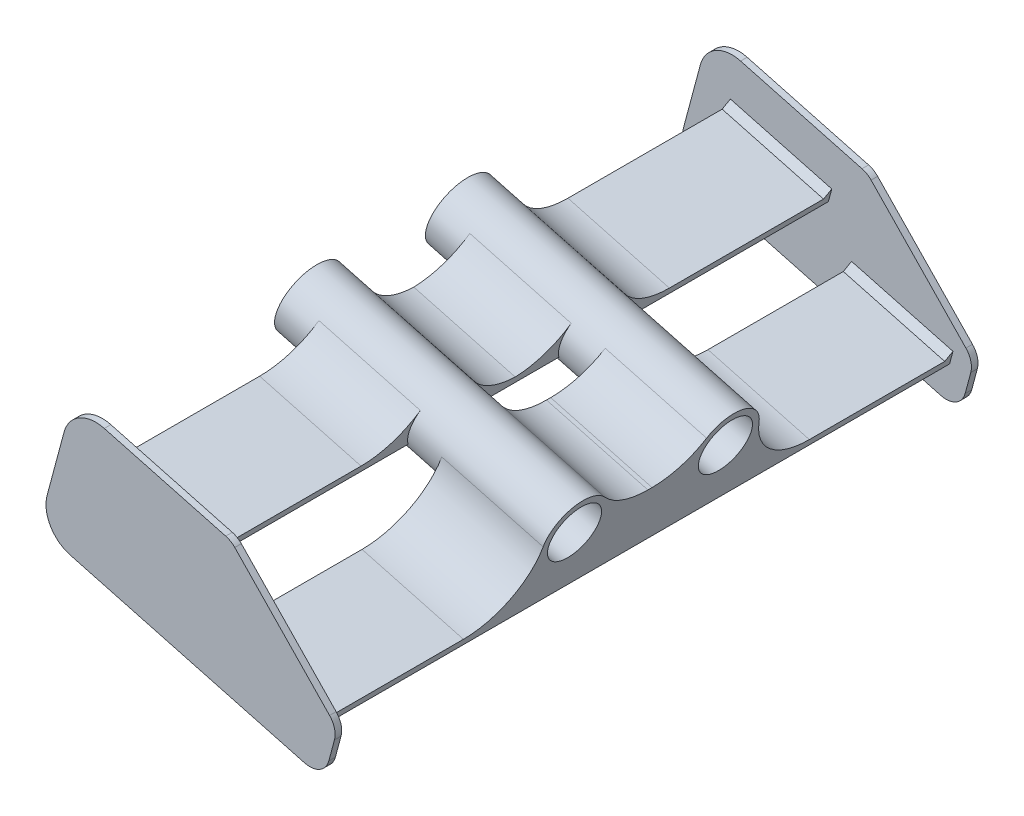
from build123d import *

# Parameters (mm, degrees)
BOSS_EXTRUDE1_DEPTH = 1
BOSS_EXTRUDE2_DEPTH = 96
BOSS_EXTRUDE3_DEPTH = 1
BOSS_EXTRUDE4_DEPTH = 16
EXTRUDE_THIN1_REACH = 110.549
CUT_EXTRUDE1_DEPTH  = 102.965680501
CUT_EXTRUDE2_DEPTH  = 102.965680501
FILLET1_START       = -19
FILLET1_DEPTH       = 16
FILLET2_R           = 10
FILLET3_R           = 10
FILLET4_R           = 10
CHAMFER1_SIZE       = 1
CHAMFER2_SIZE       = 1
SKETCH8_R           = 1
CUT_EXTRUDE3_DEPTH  = 3


with BuildPart() as part:
    # Sketch1 → Boss-Extrude1 (new body)
    with BuildSketch(Plane.XY):
        with BuildLine():
            Line((-1.180699325, 1.221103194), (-15.635082302, 16.170119303))
            ThreePointArc((-15.635082302, 16.170119303), (-16.269985561, 16.670148445), (-17.01532588, 16.982556993))
            Line((-17.01532588, 16.982556993), (-35.53120451, 21.94387172))
            ThreePointArc((-35.53120451, 21.94387172), (-39.325299736, 21.444369607), (-41.654928867, 18.408337814))
            Line((-41.654928867, 18.408337814), (-44.243119318, 8.749079551))
            ThreePointArc((-44.243119318, 8.749079551), (-43.743617206, 4.954984325), (-40.707585412, 2.625355194))
            Line((-40.707585412, 2.625355194), (-4.96832984, -6.950949475))
            ThreePointArc((-4.96832984, -6.950949475), (-2.691872704, -6.651248207), (-1.294095226, -4.829629131))
            Line((-1.294095226, -4.829629131), (-0.43962256, -1.640693729))
            ThreePointArc((-0.43962256, -1.640693729), (-0.433194836, -0.11217799), (-1.180699325, 1.221103194))
        make_face()
    extrude(amount=-BOSS_EXTRUDE1_DEPTH)

    # Sketch2 → Boss-Extrude2 (add)
    with BuildSketch(Plane(origin=(0, 0, -1), x_dir=(-1, 0, 0), z_dir=(0, 0, -1))):
        Polygon((3.415415569, -1.155394517), (3.674234614, -2.121320344), (19.129047835, 2.019784378), (18.87022879, 2.985710204), align=None)
        Polygon((21.888124605, 11.041286214), (22.146943651, 10.075360388), (37.601756871, 14.216465109), (37.342937826, 15.182390936), align=None)
    extrude(amount=BOSS_EXTRUDE2_DEPTH)

    # Sketch3 → Boss-Extrude3 (add)
    with BuildSketch(Plane(origin=(0, 0, -97), x_dir=(-1, 0, 0), z_dir=(0, 0, -1))):
        with BuildLine():
            Line((4.96832984, -6.950949475), (40.707585412, 2.625355194))
            ThreePointArc((40.707585412, 2.625355194), (43.743617206, 4.954984325), (44.243119318, 8.749079551))
            Line((44.243119318, 8.749079551), (41.654928867, 18.408337814))
            ThreePointArc((41.654928867, 18.408337814), (39.325299736, 21.444369607), (35.53120451, 21.94387172))
            Line((35.53120451, 21.94387172), (17.01532588, 16.982556993))
            ThreePointArc((17.01532588, 16.982556993), (16.269985561, 16.670148445), (15.635082302, 16.170119303))
            Line((15.635082302, 16.170119303), (1.180699325, 1.221103194))
            ThreePointArc((1.180699325, 1.221103194), (0.433194836, -0.11217799), (0.43962256, -1.640693729))
            Line((0.43962256, -1.640693729), (1.294095226, -4.829629131))
            ThreePointArc((1.294095226, -4.829629131), (2.691872704, -6.651248207), (4.96832984, -6.950949475))
        make_face()
    extrude(amount=BOSS_EXTRUDE3_DEPTH)

    # Sketch4 → Boss-Extrude4 (add)
    with BuildSketch(Plane(origin=(-2.897777479, 0.776457135, 0), x_dir=(0, 0, -1), z_dir=(0.9659258262890703, -0.25881904510251386, 0))):
        with BuildLine():
            Line((49, 6), (49, -2))
            Line((49, -2), (65.5, -2))
            Line((65.5, -2), (65.5, 6))
            ThreePointArc((65.5, 6), (60.5, 1), (55.5, 6))
            Line((55.5, 6), (49, 6))
        make_face()
        with BuildLine():
            Line((32.5, 6), (32.5, -2))
            Line((32.5, -2), (49, -2))
            Line((49, -2), (49, 6))
            Line((49, 6), (42.5, 6))
            ThreePointArc((42.5, 6), (37.5, 1), (32.5, 6))
        make_face()
    extrude(amount=-BOSS_EXTRUDE4_DEPTH)

    # Extrude-Thin1: up to this face of the body (flat: up to its plane)
    extrude_thin1_end = Plane(part.part.faces().sort_by_distance((-42.949024093, 13.578708682, -97.5))[0])
    # Sketch5 → Extrude-Thin1 (add, up to the picked face)
    with BuildSketch(Plane(origin=(-2.897777479, 0.776457135, 0), x_dir=(0, 0, -1), z_dir=(0.9659258262890703, -0.25881904510251386, 0)), mode=Mode.PRIVATE) as extrude_thin1_sk1:
        with BuildLine():
            ThreePointArc((55.5, 6), (60.5, 1), (65.5, 6))
            ThreePointArc((65.5, 6), (60.5, 11), (55.5, 6))
        make_face()
        with BuildLine():
            ThreePointArc((56.5, 6), (60.5, 2), (64.5, 6))
            ThreePointArc((64.5, 6), (60.5, 10), (56.5, 6))
        make_face(mode=Mode.SUBTRACT)
    extrude_thin1_tool1 = split(extrude(extrude_thin1_sk1.sketch, amount=-EXTRUDE_THIN1_REACH, mode=Mode.PRIVATE), bisect_by=extrude_thin1_end, keep=Keep.BOTH, mode=Mode.PRIVATE)
    # Sketch5 → Extrude-Thin1 (add, up to the picked face)
    with BuildSketch(Plane(origin=(-2.897777479, 0.776457135, 0), x_dir=(0, 0, -1), z_dir=(0.9659258262890703, -0.25881904510251386, 0)), mode=Mode.PRIVATE) as extrude_thin1_sk2:
        with BuildLine():
            ThreePointArc((32.5, 6), (37.5, 1), (42.5, 6))
            ThreePointArc((42.5, 6), (37.5, 11), (32.5, 6))
        make_face()
        with BuildLine():
            ThreePointArc((33.5, 6), (37.5, 2), (41.5, 6))
            ThreePointArc((41.5, 6), (37.5, 10), (33.5, 6))
        make_face(mode=Mode.SUBTRACT)
    extrude_thin1_tool2 = split(extrude(extrude_thin1_sk2.sketch, amount=-EXTRUDE_THIN1_REACH, mode=Mode.PRIVATE), bisect_by=extrude_thin1_end, keep=Keep.BOTH, mode=Mode.PRIVATE)
    add(extrude_thin1_tool1.solids().sort_by(Axis((-2.602356, 1.878986, -60.5), (-0.9659258262890703, 0.25881904510251386, 0)))[0])
    add(extrude_thin1_tool2.solids().sort_by(Axis((-2.602356, 1.878986, -37.5), (-0.9659258262890703, 0.25881904510251386, 0)))[0])

    # Sketch6 → Cut-Extrude1 (cut, through all)
    with BuildSketch(Plane(origin=(-23.182219831, 6.211657082, 0), x_dir=(0, 0, -1), z_dir=(0.9659258262890705, -0.2588190451025127, 0))):
        with BuildLine():
            Line((57.035898385, 4), (63.964101615, 4))
            ThreePointArc((63.964101615, 4), (64.202459174, 4.486132084), (64.372983346, 5))
            Line((64.372983346, 5), (56.627016654, 5))
            ThreePointArc((56.627016654, 5), (56.797540826, 4.486132084), (57.035898385, 4))
        make_face()
    extrude(amount=-CUT_EXTRUDE1_DEPTH, mode=Mode.SUBTRACT)

    # Sketch7 → Cut-Extrude2 (cut, through all)
    with BuildSketch(Plane(origin=(-23.182219831, 6.211657082, 0), x_dir=(0, 0, -1), z_dir=(0.9659258262890704, -0.25881904510251263, 0))):
        with BuildLine():
            Line((34.035898385, 4), (40.964101615, 4))
            ThreePointArc((40.964101615, 4), (41.202459174, 4.486132084), (41.372983346, 5))
            Line((41.372983346, 5), (33.627016654, 5))
            ThreePointArc((33.627016654, 5), (33.797540826, 4.486132084), (34.035898385, 4))
        make_face()
    extrude(amount=-CUT_EXTRUDE2_DEPTH, mode=Mode.SUBTRACT)

    # Fillet1: read off the stored shape, not the designer's step
    # Fillet1 outline → Fillet1 (add)
    with BuildSketch(Plane(origin=(0, 0, 0), x_dir=(0.2588190451025141, 0.96592582628907, 0), z_dir=(0.9659258262890701, -0.2588190451025141, 0)).offset(FILLET1_START)):
        with BuildLine():
            ThreePointArc((6.666666667, -32.544643751), (0.472273473, -29.216737139), (-2, -22.633931253))
            Line((-2, -22.633931253), (-2, -32.5))
            Line((-2, -32.5), (6, -32.5))
            ThreePointArc((6, -32.5), (6.334079897, -32.511173422), (6.666666667, -32.544643751))
        make_face()
        with BuildLine():
            ThreePointArc((-2, -75.366068747), (0.472273473, -68.783262861), (6.666666667, -65.455356249))
            ThreePointArc((6.666666667, -65.455356249), (6.334079897, -65.488826578), (6, -65.5))
            Line((6, -65.5), (-2, -65.5))
            Line((-2, -65.5), (-2, -75.366068747))
        make_face()
    extrude(amount=FILLET1_DEPTH)

    # Fillet2
    # the kernel refuses this fillet: 10 mm, written as the material it adds along each edge
    with BuildSketch(Plane(origin=(-37.342937826, 15.182390936, -65.398979486), x_dir=(0, 0, -1), z_dir=(0.9659258262890703, -0.25881904510251386, 0))) as fillet2_piece_1:
        with BuildLine():
            CenterArc((7.101020514, 10), FILLET2_R, 216.869897646, 53.130102354)
            ThreePointArc((-0.898979486, 4), (-0.020664308, 2.096376317), (0, 0))
            Line((0, 0), (7.101020514, 0))
        make_face()
    extrude(amount=16)
    with BuildSketch(Plane(origin=(-37.342937826, 15.182390936, -32.601020514), x_dir=(0.25252017519049164, 0.9424181237471358, -0.21927526343546186), z_dir=(0.9659258262890703, -0.25881904510251386, 0))) as fillet2_piece_2:
        with BuildLine():
            CenterArc((8.199552211, 9.120955865), FILLET2_R, 192.666469307, 53.130102354)
            Line((-1.557078144, 6.92820323), (0, 0))
            ThreePointArc((0, 0), (2.049888053, 0.439522068), (4.099776106, 0))
        make_face()
    extrude(amount=16)

    # Fillet3
    # the kernel refuses this fillet: 10 mm, written as the material it adds along each edge
    with BuildSketch(Plane(origin=(-37.342937826, 15.182390936, -55.601020514), x_dir=(0.252520175190492, 0.9424181237471373, -0.21927526343545575), z_dir=(0.9659258262890703, -0.25881904510251386, 0))) as fillet3_piece_1:
        with BuildLine():
            CenterArc((8.199552211, 9.120955865), FILLET3_R, 192.666469307, 53.130102354)
            Line((-1.557078144, 6.92820323), (0, 0))
            ThreePointArc((0, 0), (2.049888053, 0.439522068), (4.099776106, 0))
        make_face()
    extrude(amount=16)
    with BuildSketch(Plane(origin=(-37.342937826, 15.182390936, -42.398979486), x_dir=(0, 0, -1), z_dir=(0.9659258262890703, -0.25881904510251386, 0))) as fillet3_piece_2:
        with BuildLine():
            CenterArc((7.101020514, 10), FILLET3_R, 216.869897646, 53.130102354)
            ThreePointArc((-0.898979486, 4), (-0.020664308, 2.096376317), (0, 0))
            Line((0, 0), (7.101020514, 0))
        make_face()
    extrude(amount=16)

    # Fillet4
    # the kernel refuses this fillet: 10 mm, written as the material it adds along each edge
    with BuildSketch(Plane(origin=(-1.344863208, 6.572012093, -42.5), x_dir=(0.24178159790789314, 0.9023412077274722, 0.35682208977308716), z_dir=(-0.9659258262890703, 0.25881904510251386, 0))) as fillet4_piece_1:
        with BuildLine():
            CenterArc((7.136441795, 9.34172359), FILLET4_R, 200.905157448, 48.189685104)
            Line((-2.205281794, 5.773502692), (-2.392116266, 5.702138274))
            Line((-2.392116266, 5.702138274), (-0.186834472, -0.071364418))
            Line((-0.186834472, -0.071364418), (0.071364418, -0.186834472))
            ThreePointArc((0.071364418, -0.186834472), (1.784110449, 0.129138205), (3.49685648, -0.186834472))
            Line((3.49685648, -0.186834472), (3.568220898, 0))
        make_face()
    extrude(amount=16)
    with BuildSketch(Plane(origin=(-1.344863208, 6.572012093, -55.5), x_dir=(0.24178159790789344, 0.9023412077274733, -0.3568220897730836), z_dir=(-0.9659258262890703, 0.25881904510251386, 0))) as fillet4_piece_2:
        with BuildLine():
            CenterArc((7.136441795, -9.34172359), FILLET4_R, 110.905157448, 48.189685104)
            Line((-2.205281794, -5.773502692), (-2.392116266, -5.702138274))
            Line((-2.392116266, -5.702138274), (-0.186834472, 0.071364418))
            Line((-0.186834472, 0.071364418), (0.071364418, 0.186834472))
            ThreePointArc((0.071364418, 0.186834472), (1.784110449, -0.129138205), (3.49685648, 0.186834472))
            Line((3.49685648, 0.186834472), (3.568220898, 0))
        make_face()
    extrude(amount=16)

    # Chamfer1
    chamfer1_edges = [part.edges().sort_by_distance(p)[0] for p in [
        (-11.142822179, 0.915157844, -1),
        (-11.142822179, 0.915157844, -97),
    ]]
    chamfer(chamfer1_edges, length=CHAMFER1_SIZE)

    # Chamfer2
    chamfer2_edges = [part.edges().sort_by_distance(p)[0] for p in [
        (-29.615531216, 13.111838575, -1),
        (-29.615531216, 13.111838575, -97),
    ]]
    chamfer(chamfer2_edges, length=CHAMFER2_SIZE)

    # Sketch8 → Cut-Extrude3 (cut)
    with BuildSketch(Plane(origin=(-0.776457135, -2.897777479, 0), x_dir=(0.9659258262890701, -0.25881904510251413, 0), z_dir=(-0.25881904510251413, -0.9659258262890701, 0))):
        with Locations((-11, -49)):
            Circle(SKETCH8_R)
    extrude(amount=-CUT_EXTRUDE3_DEPTH, mode=Mode.SUBTRACT)


solid = part.part
